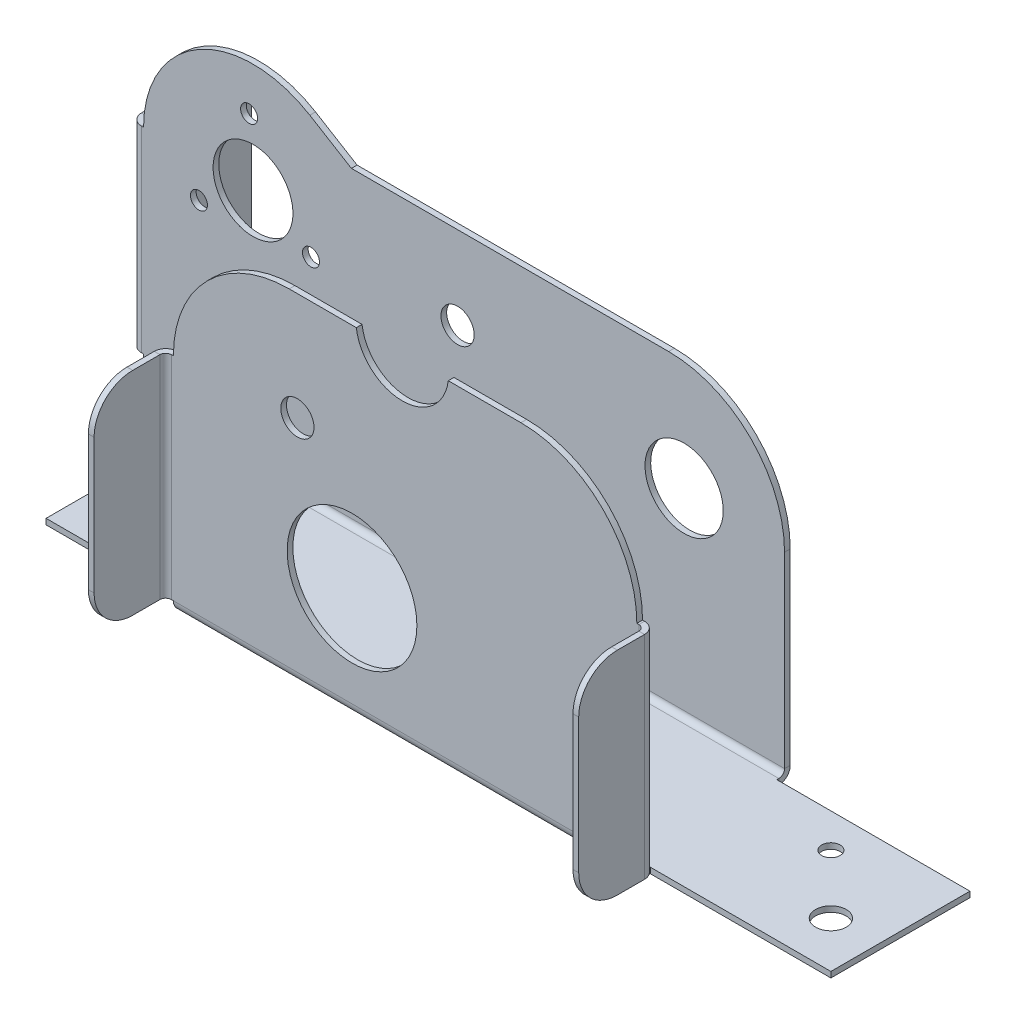
from build123d import *

# Parameters (mm, degrees)
SKETCH1_W                = 101.6
SKETCH1_H                = 18
BASE_FLANGE1_DEPTH       = 0.7366
CUT_EXTRUDE1_DEPTH       = 248.362817644
CUT_EXTRUDE1_DEPTH_BACK  = 248.362817644
SKETCH9_R                = 1.984375
SKETCH9_R_2              = 1.190625
EDGE_FLANGE2_DEPTH       = 60
CUT_EXTRUDE10_DEPTH      = 276.770749451
CUT_EXTRUDE10_DEPTH_BACK = 276.770749451
SKETCH47_R               = 5.065
SKETCH48_R               = 6
CUT_EXTRUDE11_DEPTH      = 10
EDGE_FLANGE4_DEPTH       = 76.6
EDGE_FLANGE4_START       = 0.7366
EDGE_FLANGE4_FLAT_DEPTH  = 0.7366
CUT_EXTRUDE12_DEPTH      = 105.880550385
CUT_EXTRUDE12_DEPTH_BACK = 105.880550385
SKETCH52_R               = 2.15
TAB1_START               = -0.7366
TAB1_OUTLINE_W           = 10
TAB1_OUTLINE_H           = 49.408594005
TAB1_DEPTH               = 0.7366
SKETCH56_R               = 5.065
CUT_EXTRUDE13_DEPTH      = 5
CUT_EXTRUDE16_DEPTH      = 105.732220975
CUT_EXTRUDE16_DEPTH_BACK = 105.732220975
SKETCH59_R               = 1.1
SKETCH59_R_2             = 5.17
CUT_EXTRUDE18_DEPTH      = 10
FILLET1_R                = 5
EDGE_FLANGE5_DEPTH       = 25.419820015
FILLET2_R                = 5
FILLET3_R                = 15
EDGE_FLANGE6_DEPTH       = 27.460964596
EDGE_FLANGE6_BEND_DEPTH  = 27.460964596
FILLET4_R                = 5
SKETCH71_R               = 8.39617584
CUT_EXTRUDE19_DEPTH      = 83.479179892


# Read off the part's stored shape, not the designer's step: Tab1
# Sheet-metal steps are written as plain solids
with BuildPart() as part:
    # Sketch1 → Base-Flange1 (new body)
    with BuildSketch(Plane(origin=(0, 0, 0), x_dir=(1, 0, 0), z_dir=(0, 1, 0))):
        Rectangle(SKETCH1_W, SKETCH1_H)
    extrude(amount=-BASE_FLANGE1_DEPTH)

    # Sketch9 → Cut-Extrude1 (cut, two sides: drawn at the far end of the back side and taken through both)
    with BuildSketch(Plane(origin=(-165.711822879, -0.7366, -110.626299478), x_dir=(0.7071067811865437, 0, -0.7071067811865515), z_dir=(0, 1, 0)).offset(-CUT_EXTRUDE1_DEPTH_BACK)):
        with Locations(Location((5.089841868, -165.843496765, 0), (0, 0, 135))):
            Circle(SKETCH9_R)
        with Locations(Location((15.884109726, -165.843496765, 0), (0, 0, 135))):
            Circle(SKETCH9_R_2)
        with Locations(Location((68.508410595, -229.262065492, 0), (0, 0, 135))):
            Circle(SKETCH9_R)
        with Locations(Location((68.508410595, -218.467797635, 0), (0, 0, 135))):
            Circle(SKETCH9_R_2)
    extrude(amount=CUT_EXTRUDE1_DEPTH + CUT_EXTRUDE1_DEPTH_BACK, mode=Mode.SUBTRACT)

    # Edge-Flange2 section (across the edge) → Edge-Flange2 (add)
    with BuildSketch(Plane(origin=(-32.583570882, 0, 10), x_dir=(0, 0, -1), z_dir=(1, 0, 0))):
        with BuildLine():
            Line((-0.7366, 0.7366), (-0.7366, 43.197564596))
            Line((-0.7366, 43.197564596), (0, 43.197564596))
            Line((0, 43.197564596), (0, 0.7366))
            ThreePointArc((0, 0.7366), (0.215745145, 0.215745145), (0.7366, 0))
            Line((0.7366, 0), (1, 0))
            Line((1, 0), (1, -0.7366))
            Line((1, -0.7366), (0.7366, -0.7366))
            ThreePointArc((0.7366, -0.7366), (-0.30510971, -0.30510971), (-0.7366, 0.7366))
        make_face()
    extrude(amount=EDGE_FLANGE2_DEPTH)

    # Sketch47 → Cut-Extrude10 (cut, two sides: drawn at the far end of the back side and taken through both)
    with BuildSketch(Plane(origin=(-165.711822879, -125.530580752, -15.7766), x_dir=(1, 0, 0), z_dir=(0, 0, 1)).offset(-CUT_EXTRUDE10_DEPTH_BACK)):
        with Locations((162.765212711, 169.489973714)):
            Circle(SKETCH47_R)
    extrude(amount=CUT_EXTRUDE10_DEPTH + CUT_EXTRUDE10_DEPTH_BACK, mode=Mode.SUBTRACT)

    # Sketch48 → Cut-Extrude11 (cut)
    with BuildSketch(Plane.XY.offset(10.7366)):
        with Locations((-2.946610168, 43.959392962)):
            Circle(SKETCH48_R)
    extrude(amount=-CUT_EXTRUDE11_DEPTH, mode=Mode.SUBTRACT)

    # Edge-Flange4 bend section (across the edge) → Edge-Flange4 (add)
    with BuildSketch(Plane(origin=(25.8, 0, -10), x_dir=(0, 0, 1), z_dir=(-1, 0, 0))):
        with BuildLine():
            Line((-0.7366, 0.7366), (0, 0.7366))
            ThreePointArc((0, 0.7366), (0.215745145, 0.215745145), (0.7366, 0))
            Line((0.7366, 0), (1, 0))
            Line((1, 0), (1, -0.7366))
            Line((1, -0.7366), (0.7366, -0.7366))
            ThreePointArc((0.7366, -0.7366), (-0.30510971, -0.30510971), (-0.7366, 0.7366))
        make_face()
    extrude(amount=EDGE_FLANGE4_DEPTH)

    # Edge-Flange4 profile (on flange) → Edge-Flange4 flat (add)
    with BuildSketch(Plane(origin=(0, 0, -10), x_dir=(-1, 0, 0), z_dir=(0, 0, -1)).offset(EDGE_FLANGE4_START)):
        Polygon((-25.8, 40), (-25.8, 0.7366), (50.8, 0.7366), (50.8, 40), (50.8, 50.145194005), (30.27574847, 50.145194005), (30.27574847, 40), align=None)
    extrude(amount=-EDGE_FLANGE4_FLAT_DEPTH)

    # Sketch52 → Cut-Extrude12 (cut, two sides: drawn at the far end of the back side and taken through both)
    with BuildSketch(Plane(origin=(-25.053389833, -19.029185513, -10.7366), x_dir=(-1, 0, 0), z_dir=(0, 0, -1)).offset(-CUT_EXTRUDE12_DEPTH_BACK)):
        with Locations(Location((-8.524599638, 48.296752149, 0), (0, 0, 90))):
            Circle(SKETCH52_R)
    extrude(amount=CUT_EXTRUDE12_DEPTH + CUT_EXTRUDE12_DEPTH_BACK, mode=Mode.SUBTRACT)

    # Tab1 outline → Tab1 (add)
    with BuildSketch(Plane.XY.offset(-10).offset(TAB1_START)):
        with Locations((-55.8, 25.440897003)):
            Rectangle(TAB1_OUTLINE_W, TAB1_OUTLINE_H)
    extrude(amount=TAB1_DEPTH)

    # Sketch56 → Cut-Extrude13 (cut)
    with BuildSketch(Plane(origin=(-25.053389833, -19.029185513, -11.4732), x_dir=(-1, 0, 0), z_dir=(0, 0, -1))):
        with Locations(Location((-37.853389832, 44.695992962, 0), (0, 0, 90))):
            Circle(SKETCH56_R)
    extrude(amount=-CUT_EXTRUDE13_DEPTH, mode=Mode.SUBTRACT)

    # Sketch59 → Cut-Extrude16 (cut, two sides: drawn at the far end of the back side and taken through both)
    with BuildSketch(Plane(origin=(-25.053389833, -19.029185513, -10), x_dir=(1, 0, 0), z_dir=(0, 0, 1)).offset(-CUT_EXTRUDE16_DEPTH_BACK)):
        with Locations(Location((-24.955394773, 45.581923383, 0), (0, 0, 180))):
            Circle(SKETCH59_R)
        with Locations(Location((-17.957123001, 50.185605529, 0), (0, 0, 180))):
            Circle(SKETCH59_R_2)
        with Locations(Location((-18.462707804, 58.547069581, 0), (0, 0, 180))):
            Circle(SKETCH59_R)
        with Locations(Location((-10.455133223, 46.458697096, 0), (0, 0, 180))):
            Circle(SKETCH59_R)
    extrude(amount=CUT_EXTRUDE16_DEPTH + CUT_EXTRUDE16_DEPTH_BACK, mode=Mode.SUBTRACT)

    # Sketch61 → Cut-Extrude18 (cut)
    with BuildSketch(Plane.XY.offset(-10)):
        with BuildLine():
            Line((-57.180512833, 31.156420015), (-57.180512833, 0.7366))
            Line((-57.180512833, 0.7366), (-60.8, 0.7366))
            Line((-60.8, 0.7366), (-60.8, 50.145194005))
            Line((-60.8, 50.145194005), (-30.27574847, 50.145194005))
            Line((-30.27574847, 50.145194005), (-30.27574847, 40))
            Line((-30.27574847, 40), (-35.653602425, 43.266943094))
            ThreePointArc((-35.653602425, 43.266943094), (-49.958227548, 43.506244316), (-57.180512833, 31.156420015))
        make_face()
    extrude(amount=-CUT_EXTRUDE18_DEPTH, mode=Mode.SUBTRACT)

    # Fillet1
    fillet1_edges = [part.edges().sort_by_distance(p)[0] for p in [
        (-57.180512833, 0.7366, -10.3683),
    ]]
    fillet(fillet1_edges, radius=FILLET1_R)

    # Edge-Flange5 section (across the edge) → Edge-Flange5 (add)
    with BuildSketch(Plane(origin=(-58.180512833, 5.7366, -10.7366), x_dir=(1, 0, 0), z_dir=(0, 1, 0))):
        with BuildLine():
            Line((-0.7366, 0.7366), (-0.7366, 14.2634))
            Line((-0.7366, 14.2634), (0, 14.2634))
            Line((0, 14.2634), (0, 0.7366))
            ThreePointArc((0, 0.7366), (0.215745145, 0.215745145), (0.7366, 0))
            Line((0.7366, 0), (1, 0))
            Line((1, 0), (1, -0.7366))
            Line((1, -0.7366), (0.7366, -0.7366))
            ThreePointArc((0.7366, -0.7366), (-0.30510971, -0.30510971), (-0.7366, 0.7366))
        make_face()
    extrude(amount=EDGE_FLANGE5_DEPTH)

    # Fillet2
    fillet2_edges = [part.edges().sort_by_distance(p)[0] for p in [
        (-58.548812833, 5.7366, -25),
        (-58.548812833, 31.156420015, -25),
    ]]
    fillet(fillet2_edges, radius=FILLET2_R)

    # Fillet3
    fillet3_edges = [part.edges().sort_by_distance(p)[0] for p in [
        (25.8, 40, -10.3683),
        (-32.583570882, 43.197564596, 10.3683),
        (27.416429118, 43.197564596, 10.3683),
    ]]
    fillet(fillet3_edges, radius=FILLET3_R)

    # Edge-Flange6 section (across the edge) → Edge-Flange6 (add)
    with BuildSketch(Plane(origin=(28.416429118, 0.7366, 10.7366), x_dir=(-1, 0, 0), z_dir=(0, 1, 0))):
        with BuildLine():
            Line((-0.7366, 0.7366), (-0.7366, 9.2634))
            Line((-0.7366, 9.2634), (0, 9.2634))
            Line((0, 9.2634), (0, 0.7366))
            ThreePointArc((0, 0.7366), (0.215745145, 0.215745145), (0.7366, 0))
            Line((0.7366, 0), (1, 0))
            Line((1, 0), (1, -0.7366))
            Line((1, -0.7366), (0.7366, -0.7366))
            ThreePointArc((0.7366, -0.7366), (-0.30510971, -0.30510971), (-0.7366, 0.7366))
        make_face()
    extrude(amount=EDGE_FLANGE6_DEPTH)

    # Edge-Flange6 section 2 (across the edge) → Edge-Flange6 bend (add)
    with BuildSketch(Plane(origin=(-33.583570882, 28.197564596, 10.7366), x_dir=(1, 0, 0), z_dir=(0, -1, 0))):
        with BuildLine():
            Line((-0.7366, 0.7366), (-0.7366, 9.2634))
            Line((-0.7366, 9.2634), (0, 9.2634))
            Line((0, 9.2634), (0, 0.7366))
            ThreePointArc((0, 0.7366), (0.215745145, 0.215745145), (0.7366, 0))
            Line((0.7366, 0), (1, 0))
            Line((1, 0), (1, -0.7366))
            Line((1, -0.7366), (0.7366, -0.7366))
            ThreePointArc((0.7366, -0.7366), (-0.30510971, -0.30510971), (-0.7366, 0.7366))
        make_face()
    extrude(amount=EDGE_FLANGE6_BEND_DEPTH)

    # Fillet4
    fillet4_edges = [part.edges().sort_by_distance(p)[0] for p in [
        (28.784729118, 0.7366, 20),
        (28.784729118, 28.197564596, 20),
        (-33.951870882, 28.197564596, 20),
        (-33.951870882, 0.7366, 20),
    ]]
    fillet(fillet4_edges, radius=FILLET4_R)

    # Sketch71 → Cut-Extrude19 (cut, through all)
    with BuildSketch(Plane.XY.offset(10.7366)):
        with Locations((-9.454494987, 13.710785706)):
            Circle(SKETCH71_R)
    extrude(amount=-CUT_EXTRUDE19_DEPTH, mode=Mode.SUBTRACT)


solid = part.part
